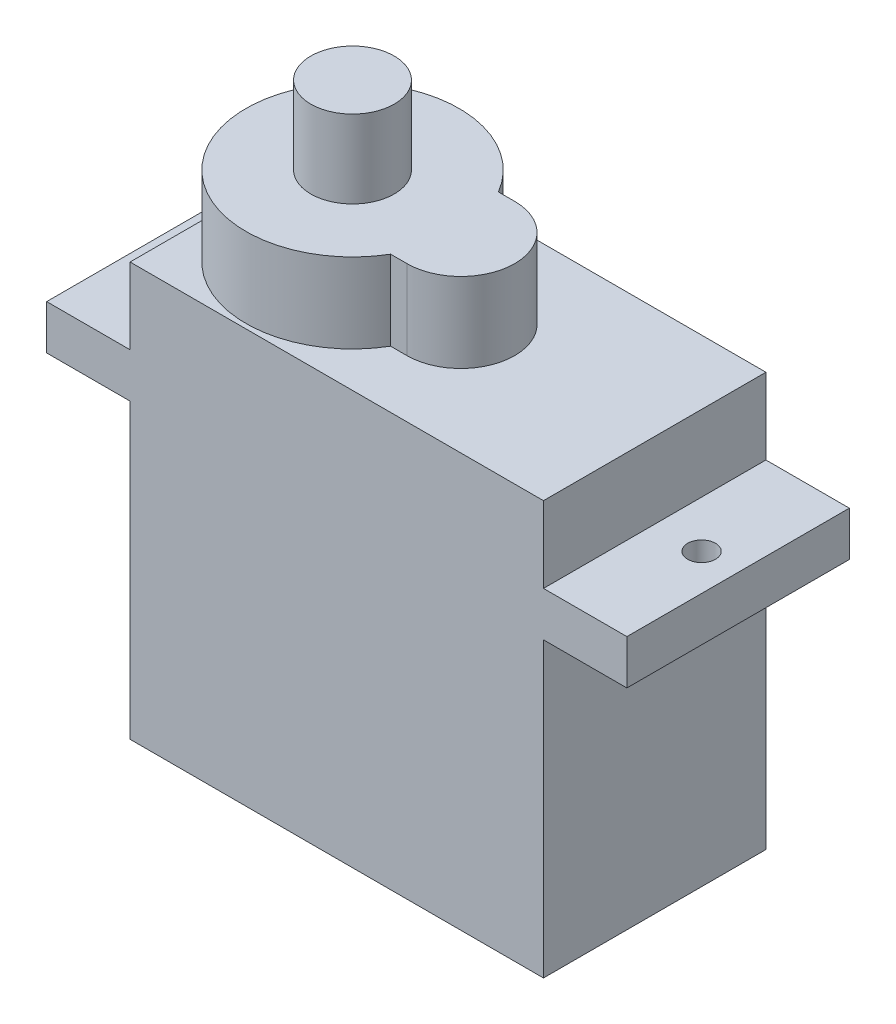
from build123d import *

# Parameters (mm, degrees)
SKETCH1_W           = 22.3
SKETCH1_H           = 12
BOSS_EXTRUDE1_DEPTH = 22.3
SKETCH2_W           = 12
SKETCH2_H           = 2.4
BOSS_EXTRUDE2_DEPTH = 4.5
EXTRUDE_1_DEPTH     = 4.3
SKETCH_1_R          = 0.75
CUT_EXTRUDE_1_DEPTH = 10
SKETCH_2_R          = 2.25
EXTRUDE_2_DEPTH     = 4.2


with BuildPart() as part:
    # Sketch1 → Boss-Extrude1 (new body)
    with BuildSketch(Plane(origin=(0, 0, 0), x_dir=(1, 0, 0), z_dir=(0, 1, 0))):
        Rectangle(SKETCH1_W, SKETCH1_H)
    extrude(amount=BOSS_EXTRUDE1_DEPTH)

    # Sketch2 → Boss-Extrude2 (add)
    with BuildSketch(Plane.ZY.offset(11.15)):
        with Locations((0, 17)):
            Rectangle(SKETCH2_W, SKETCH2_H)
    boss_extrude2 = extrude(amount=BOSS_EXTRUDE2_DEPTH)

    # 镜向1: Boss-Extrude2 across plane
    add(boss_extrude2.mirror(Plane(origin=(0, 0, 0), x_dir=(0, 0, 1), z_dir=(1, 0, 0))))

    # Sketch5 → 凸台-拉伸1 (add)
    with BuildSketch(Plane(origin=(0, 22.3, 0), x_dir=(1, 0, 0), z_dir=(0, 1, 0))):
        with BuildLine():
            Line((0.693260261, 2.906739739), (-0.188814246, 2.906739739))
            ThreePointArc((-0.188814246, 2.906739739), (-10.9, 0), (-0.188814246, -2.906739739))
            Line((-0.188814246, -2.906739739), (0.693260261, -2.906739739))
            ThreePointArc((0.693260261, -2.906739739), (3.6, 0), (0.693260261, 2.906739739))
        make_face()
    extrude(amount=EXTRUDE_1_DEPTH)

    # 草图1 → 切除-拉伸1 (cut)
    with BuildSketch(Plane(origin=(0, 18.2, 0), x_dir=(1, 0, 0), z_dir=(0, 1, 0))):
        with Locations((-13.68, 0)):
            Circle(SKETCH_1_R)
        with Locations((13.68, 0)):
            Circle(SKETCH_1_R)
    extrude(amount=-CUT_EXTRUDE_1_DEPTH, mode=Mode.SUBTRACT)

    # 草图2 → 凸台-拉伸2 (add)
    with BuildSketch(Plane(origin=(0, 26.6, 0), x_dir=(1, 0, 0), z_dir=(0, 1, 0))):
        with Locations((-5.15, 0)):
            Circle(SKETCH_2_R)
    extrude(amount=EXTRUDE_2_DEPTH)


solid = part.part
